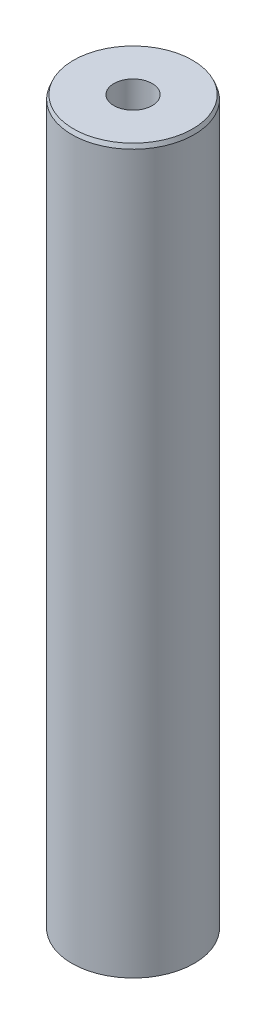
from build123d import *
from OCP.BRepFilletAPI import BRepFilletAPI_MakeChamfer

# Parameters (mm, degrees)
SKETCH1_R           = 12.5
BOSS_EXTRUDE1_DEPTH = 147.868276383
SKETCH2_R           = 3.919797379
CUT_EXTRUDE1_DEPTH  = 149.921211251
CHAMFER1_SIZE       = 0.84630102
CHAMFER1_SIZE2      = 0.333130984


with BuildPart() as part:
    # Sketch1 → Boss-Extrude1 (new body)
    with BuildSketch(Plane(origin=(0, 0, 0), x_dir=(1, 0, 0), z_dir=(0, 1, 0))):
        Circle(SKETCH1_R)
    extrude(amount=BOSS_EXTRUDE1_DEPTH)

    # Sketch2 → Cut-Extrude1 (cut, through all)
    with BuildSketch(Plane(origin=(0, 0, 0), x_dir=(1, 0, 0), z_dir=(0, 1, 0))):
        Circle(SKETCH2_R)
    extrude(amount=CUT_EXTRUDE1_DEPTH, mode=Mode.SUBTRACT)

    # Chamfer1: one chamfer whose edges measure the first distance from different faces: ONE call of the kernel's chamfer builder (chamfer() names one face for all edges)
    chamfer1_edges_1 = [part.edges().sort_by_distance(p)[0] for p in [
        (-12.5, 147.868276383, 0),
    ]]
    chamfer1_side_1 = [part.faces().sort_by_distance(p)[0] for p in [
        (-12.5, 73.934138192, 0),
    ]]
    chamfer1_edges_2 = [part.edges().sort_by_distance(p)[0] for p in [
        (-12.5, 0, 0),
    ]]
    chamfer1_side_2 = [part.faces().sort_by_distance(p)[0] for p in [
        (-12.146446609, 0, 0),
    ]]
    chamfer1 = BRepFilletAPI_MakeChamfer(part.part.solid().wrapped)
    for e in chamfer1_edges_1:
        chamfer1.Add(CHAMFER1_SIZE, CHAMFER1_SIZE2, e.wrapped, chamfer1_side_1[0].wrapped)  # the first distance lies on this face
    for e in chamfer1_edges_2:
        chamfer1.Add(CHAMFER1_SIZE, CHAMFER1_SIZE2, e.wrapped, chamfer1_side_2[0].wrapped)  # the first distance lies on this face
    add(Compound.cast(chamfer1.Shape()), mode=Mode.REPLACE)


solid = part.part
